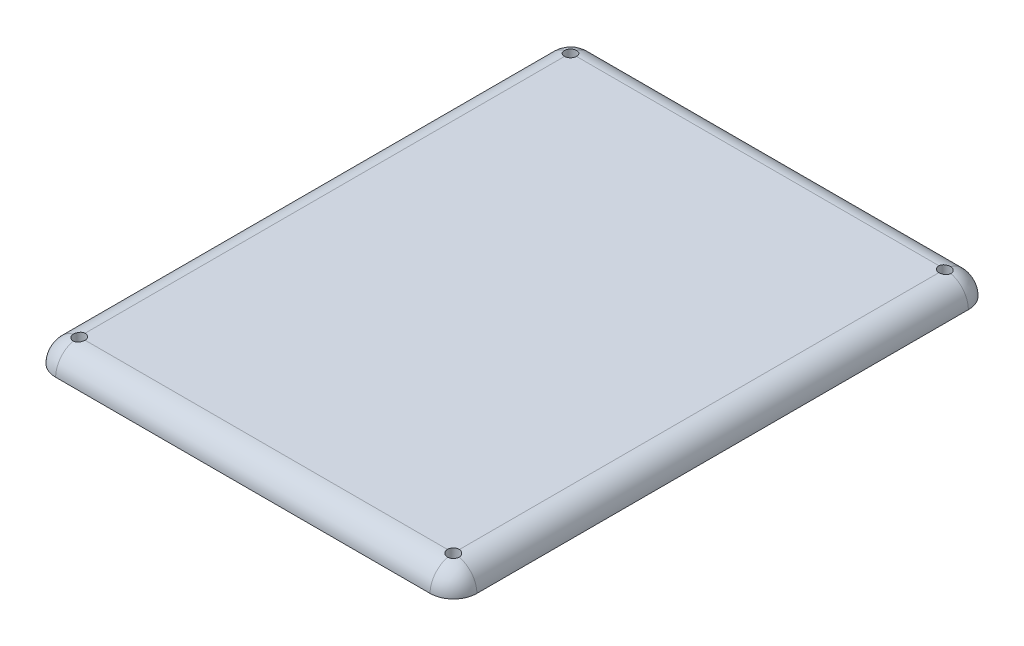
from build123d import *

# Parameters (mm, degrees)
SKETCH1_W           = 90
SKETCH1_H           = 115
BOSS_EXTRUDE1_DEPTH = 5
FILLET4_R           = 5
FILLET5_R           = 5
FILLET6_R           = 5
FILLET7_R           = 5
SKETCH4_W           = 25.5
SKETCH4_H           = 5
BOSS_EXTRUDE2_DEPTH = 5
FILLET12_R          = 2.5
FILLET13_R          = 2.5
SKETCH7_R           = 1.27
CUT_EXTRUDE2_DEPTH  = 74.186405842


with BuildPart() as part:
    # Sketch1 → Boss-Extrude1 (new body)
    with BuildSketch(Plane(origin=(0, 0, 0), x_dir=(1, 0, 0), z_dir=(0, 1, 0))):
        Rectangle(SKETCH1_W, SKETCH1_H)
    extrude(amount=BOSS_EXTRUDE1_DEPTH)

    # Fillet4
    fillet4_edges = [part.edges().sort_by_distance(p)[0] for p in [
        (0, 5, 57.5),
    ]]
    fillet(fillet4_edges, radius=FILLET4_R - 0.0001)  # a hair under: the kernel refuses the full size

    # Fillet5
    fillet5_edges = [part.edges().sort_by_distance(p)[0] for p in [
        (-45, 5, -2.49995),
        (-45, 3.535563195, 56.035563195),
    ]]
    fillet(fillet5_edges, radius=FILLET5_R - 0.0001)  # a hair under: the kernel refuses the full size

    # Fillet6
    fillet6_edges = [part.edges().sort_by_distance(p)[0] for p in [
        (45, 5, -2.49995),
        (45, 3.535563195, 56.035563195),
    ]]
    fillet(fillet6_edges, radius=FILLET6_R - 0.0001)  # a hair under: the kernel refuses the full size

    # Fillet7
    fillet7_edges = [part.edges().sort_by_distance(p)[0] for p in [
        (-43.535563195, 3.535563195, -57.5),
        (0, 5, -57.5),
        (43.535563195, 3.535563195, -57.5),
    ]]
    fillet(fillet7_edges, radius=FILLET7_R - 0.0001)  # a hair under: the kernel refuses the full size

    # Sketch4 → Boss-Extrude2 (add)
    with BuildSketch(Plane.XZ):
        with Locations((27.25, 33.466653617)):
            Rectangle(SKETCH4_W, SKETCH4_H)
    extrude(amount=BOSS_EXTRUDE2_DEPTH)

    # Fillet12
    fillet12_edges = [part.edges().sort_by_distance(p)[0] for p in [
        (27.25, -5, 35.966653617),
    ]]
    fillet(fillet12_edges, radius=FILLET12_R)

    # Fillet13
    fillet13_edges = [part.edges().sort_by_distance(p)[0] for p in [
        (27.25, -5, 30.966653617),
    ]]
    fillet(fillet13_edges, radius=FILLET13_R - 0.0001)  # a hair under: the kernel refuses the full size

    # Sketch7 → Cut-Extrude2 (cut, through all)
    with BuildSketch(Plane.XZ):
        with Locations(Location((-40, -52.5, 0), (0, 0, 270))):
            Circle(SKETCH7_R)
        with Locations(Location((40.003969698, -52.469833039, 0), (0, 0, 270))):
            Circle(SKETCH7_R)
        with Locations(Location((39.961684065, 52.494524109, 0), (0, 0, 270))):
            Circle(SKETCH7_R)
        with Locations(Location((-39.980749964, 52.482200306, 0), (0, 0, 270))):
            Circle(SKETCH7_R)
    extrude(amount=-CUT_EXTRUDE2_DEPTH, mode=Mode.SUBTRACT)


solid = part.part
